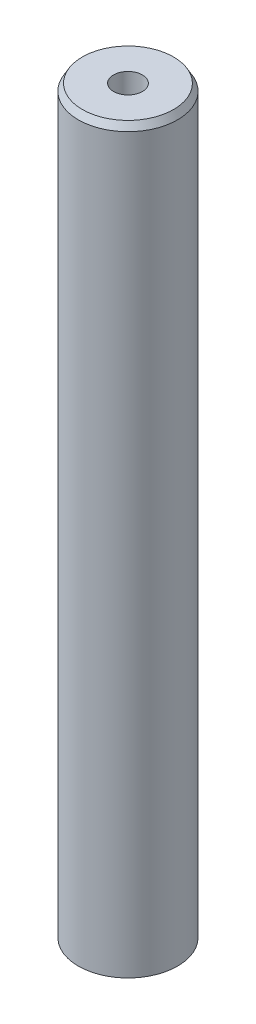
from build123d import *
from OCP.BRepFilletAPI import BRepFilletAPI_MakeChamfer

# Parameters (mm, degrees)
SKETCH1_R           = 40
BOSS_EXTRUDE1_DEPTH = 600
SKETCH2_R           = 11.64419706
CUT_EXTRUDE1_DEPTH  = 603.660766933
CHAMFER1_SIZE       = 5.598399111
CHAMFER1_SIZE2      = 3.232237234


with BuildPart() as part:
    # Sketch1 → Boss-Extrude1 (new body)
    with BuildSketch(Plane(origin=(0, 0, 0), x_dir=(1, 0, 0), z_dir=(0, 1, 0))):
        Circle(SKETCH1_R)
    extrude(amount=BOSS_EXTRUDE1_DEPTH)

    # Sketch2 → Cut-Extrude1 (cut, through all)
    with BuildSketch(Plane(origin=(0, 0, 0), x_dir=(1, 0, 0), z_dir=(0, 1, 0))):
        Circle(SKETCH2_R)
    extrude(amount=CUT_EXTRUDE1_DEPTH, mode=Mode.SUBTRACT)

    # Chamfer1: one chamfer whose edges measure the first distance from different faces: ONE call of the kernel's chamfer builder (chamfer() names one face for all edges)
    chamfer1_edges_1 = [part.edges().sort_by_distance(p)[0] for p in [
        (-40, 600, 0),
    ]]
    chamfer1_side_1 = [part.faces().sort_by_distance(p)[0] for p in [
        (-40, 300, 0),
    ]]
    chamfer1_edges_2 = [part.edges().sort_by_distance(p)[0] for p in [
        (-40, 0, 0),
    ]]
    chamfer1_side_2 = [part.faces().sort_by_distance(p)[0] for p in [
        (-38.86862915, 0, 0),
    ]]
    chamfer1 = BRepFilletAPI_MakeChamfer(part.part.solid().wrapped)
    for e in chamfer1_edges_1:
        chamfer1.Add(CHAMFER1_SIZE, CHAMFER1_SIZE2, e.wrapped, chamfer1_side_1[0].wrapped)  # the first distance lies on this face
    for e in chamfer1_edges_2:
        chamfer1.Add(CHAMFER1_SIZE, CHAMFER1_SIZE2, e.wrapped, chamfer1_side_2[0].wrapped)  # the first distance lies on this face
    add(Compound.cast(chamfer1.Shape()), mode=Mode.REPLACE)


solid = part.part
